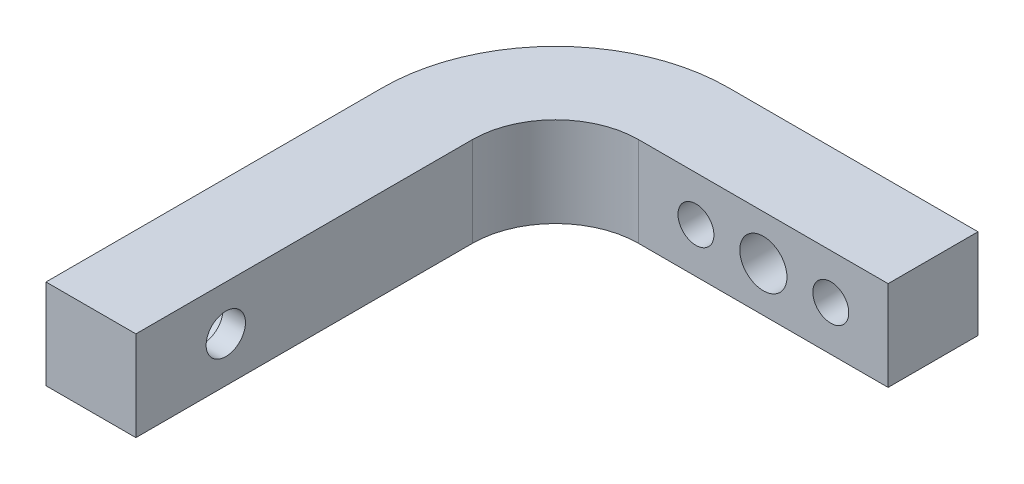
from build123d import *

# Parameters (mm, degrees)
BOSS_EXTRUDE1_DEPTH      = 4
BOSS_EXTRUDE1_DEPTH_BACK = 4
CUT_EXTRUDE1_DEPTH       = 55.294342247
CUT_EXTRUDE1_DEPTH_BACK  = 55.294342247
SKETCH2_R                = 1.75
SKETCH3_R                = 2.1
SKETCH3_R_2              = 1.6
CUT_EXTRUDE2_DEPTH       = 53.668449759
SKETCH4_R                = 2.275
CUT_EXTRUDE3_DEPTH       = 6
SKETCH5_R                = 3.825
CUT_EXTRUDE4_DEPTH       = 0.75


with BuildPart() as part:
    # Sketch1 → Boss-Extrude1 (new, two sides: drawn at the far end of the back side and taken through both)
    with BuildSketch(Plane(origin=(0, 0, 0), x_dir=(1, 0, 0), z_dir=(0, 1, 0)).offset(-BOSS_EXTRUDE1_DEPTH_BACK)):
        with BuildLine():
            Line((-11.1, 0), (11.1, 0))
            Line((11.1, 0), (11.1, -8))
            Line((11.1, -8), (-11.1, -8))
            ThreePointArc((-11.1, -8), (-16.332590181, -10.167409819), (-18.5, -15.4))
            Line((-18.5, -15.4), (-18.5, -45.34))
            Line((-18.5, -45.34), (-26.5, -45.34))
            Line((-26.5, -45.34), (-26.5, -15.4))
            ThreePointArc((-26.5, -15.4), (-21.98944443, -4.51055557), (-11.1, 0))
        make_face()
    extrude(amount=BOSS_EXTRUDE1_DEPTH + BOSS_EXTRUDE1_DEPTH_BACK)

    # Sketch2 → Cut-Extrude1 (cut, two sides: drawn at the far end of the back side and taken through both)
    with BuildSketch(Plane.ZY.offset(18.5).offset(-CUT_EXTRUDE1_DEPTH_BACK)):
        with Locations((37.34, 0)):
            Circle(SKETCH2_R)
    extrude(amount=CUT_EXTRUDE1_DEPTH + CUT_EXTRUDE1_DEPTH_BACK, mode=Mode.SUBTRACT)

    # Sketch3 → Cut-Extrude2 (cut, through all)
    with BuildSketch(Plane(origin=(0, 0, 0), x_dir=(-1, 0, 0), z_dir=(0, 0, -1))):
        Circle(SKETCH3_R)
        with Locations((-6, 0)):
            Circle(SKETCH3_R_2)
        with Locations((6, 0)):
            Circle(SKETCH3_R_2)
    extrude(amount=-CUT_EXTRUDE2_DEPTH, mode=Mode.SUBTRACT)

    # Sketch4 → Cut-Extrude3 (cut)
    with BuildSketch(Plane(origin=(-26.5, 0, 0), x_dir=(0, 0, -1), z_dir=(1, 0, 0))):
        with Locations((-37.34, 0)):
            Circle(SKETCH4_R)
    extrude(amount=CUT_EXTRUDE3_DEPTH, mode=Mode.SUBTRACT)

    # Sketch5 → Cut-Extrude4 (cut)
    with BuildSketch(Plane.ZY.offset(26.5)):
        with Locations((37.34, 0)):
            Circle(SKETCH5_R)
    extrude(amount=-CUT_EXTRUDE4_DEPTH, mode=Mode.SUBTRACT)


solid = part.part
